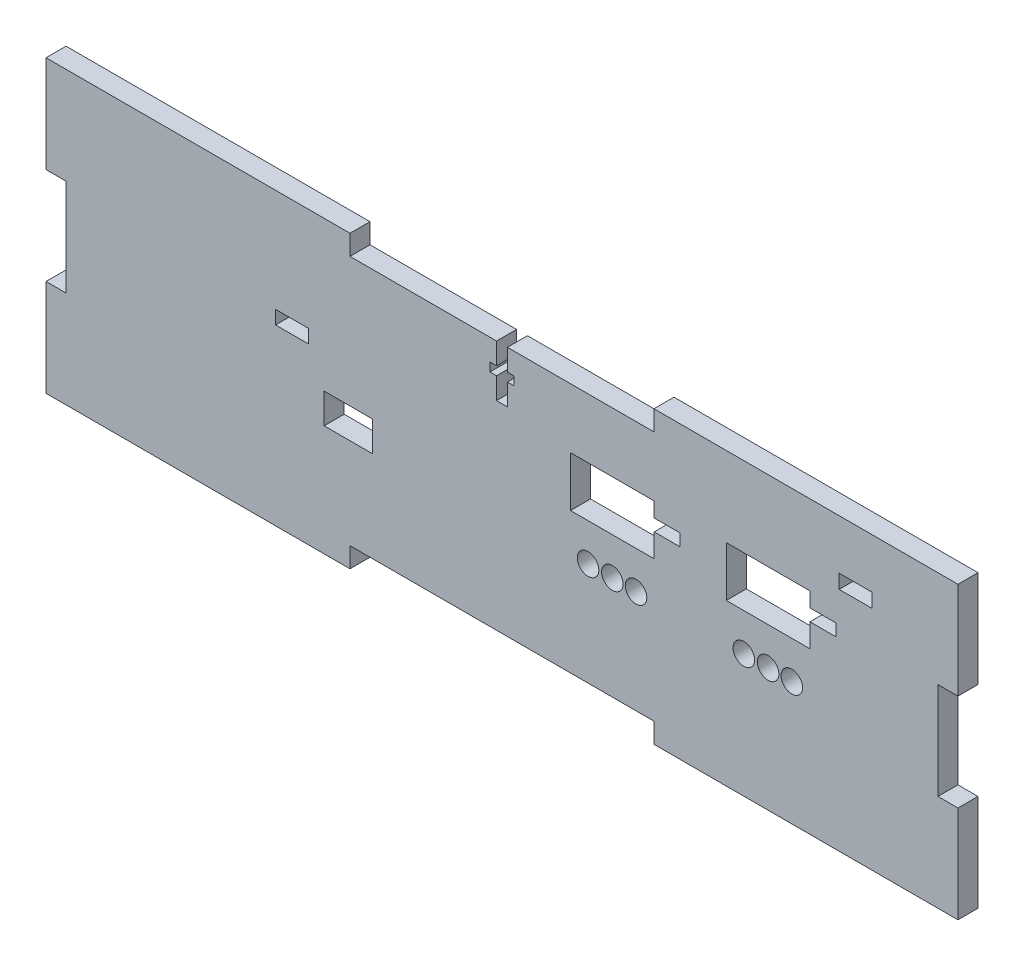
from build123d import *

# Parameters (mm, degrees)
SKETCH1_W           = 231.14
SKETCH1_H           = 73.66
BOSS_EXTRUDE1_DEPTH = 5.08
SKETCH2_W           = 77.046666666
SKETCH2_H           = 5.08
CUT_EXTRUDE1_DEPTH  = 122.402966191
SKETCH3_W           = 5.08
SKETCH3_H           = 24.553333334
CUT_EXTRUDE2_DEPTH  = 122.402966191
SKETCH5_W           = 2.7559
SKETCH5_H           = 13.081
CUT_EXTRUDE4_DEPTH  = 122.402966191
SKETCH6_W           = 6.096
SKETCH6_H           = 2.1717
CUT_EXTRUDE5_DEPTH  = 122.402966191
CAVITY1_OUTLINE_R   = 2.7305
CAVITY1_OUTLINE_W   = 12.202797109
CAVITY1_OUTLINE_H   = 7.62
CAVITY1_OUTLINE_W_2 = 8.382
CAVITY1_OUTLINE_H_2 = 3.429
CAVITY1_OUTLINE_H_3 = 3.556
CAVITY1_DEPTH       = 5.08


# Read off the part's stored shape, not the designer's step: Cavity1
with BuildPart() as part:
    # Sketch1 → Boss-Extrude1 (new body)
    with BuildSketch(Plane.XY):
        Rectangle(SKETCH1_W, SKETCH1_H)
    extrude(amount=BOSS_EXTRUDE1_DEPTH)

    # Sketch2 → Cut-Extrude1 (cut, through all)
    with BuildSketch(Plane.XY.offset(5.08)):
        with Locations((0, -34.29)):
            Rectangle(SKETCH2_W, SKETCH2_H)
        with Locations((0, 34.29)):
            Rectangle(SKETCH2_W, SKETCH2_H)
    extrude(amount=-CUT_EXTRUDE1_DEPTH, mode=Mode.SUBTRACT)

    # Sketch3 → Cut-Extrude2 (cut, through all)
    with BuildSketch(Plane.XY.offset(5.08)):
        with Locations((-113.03, 0)):
            Rectangle(SKETCH3_W, SKETCH3_H)
        with Locations((113.03, 0)):
            Rectangle(SKETCH3_W, SKETCH3_H)
    extrude(amount=-CUT_EXTRUDE2_DEPTH, mode=Mode.SUBTRACT)

    # Sketch5 → Cut-Extrude4 (cut, through all)
    with BuildSketch(Plane.XY.offset(5.08)):
        with Locations((0, 25.2095)):
            Rectangle(SKETCH5_W, SKETCH5_H)
    extrude(amount=-CUT_EXTRUDE4_DEPTH, mode=Mode.SUBTRACT)

    # Sketch6 → Cut-Extrude5 (cut, through all)
    with BuildSketch(Plane.XY.offset(5.08)):
        with Locations((0, 25.2095)):
            Rectangle(SKETCH6_W, SKETCH6_H)
    extrude(amount=-CUT_EXTRUDE5_DEPTH, mode=Mode.SUBTRACT)

    # Cavity1 outline → Cavity1 (cut)
    with BuildSketch(Plane.XY):
        with Locations((21.814879295, -5.588)):
            Circle(CAVITY1_OUTLINE_R)
        with Locations((27.972778565, -5.588)):
            Circle(CAVITY1_OUTLINE_R)
        with Locations((33.971893142, -5.588)):
            Circle(CAVITY1_OUTLINE_R)
        Polygon((38.577278565, 12.877703873), (38.577278565, 16.614191805), (17.368278565, 16.614191805), (17.368278565, 3.914191805), (38.577278565, 3.914191805), (38.577278565, 9.829703873), (45.181278565, 9.829703873), (45.181278565, 12.877703873), align=None)
        Polygon((56.847527144, 3.914191805), (78.056527144, 3.914191805), (78.056527144, 9.829703873), (84.660527144, 9.829703873), (84.660527144, 12.877703873), (78.056527144, 12.877703873), (78.056527144, 16.614191805), (56.847527144, 16.614191805), align=None)
        with Locations((61.294127875, -5.588)):
            Circle(CAVITY1_OUTLINE_R)
        with Locations((67.452027144, -5.588)):
            Circle(CAVITY1_OUTLINE_R)
        with Locations((73.451141721, -5.588)):
            Circle(CAVITY1_OUTLINE_R)
        with Locations((-38.971851196, -4.900880915)):
            Rectangle(CAVITY1_OUTLINE_W, CAVITY1_OUTLINE_H)
        with Locations((-53.192397728, 8.983802784)):
            Rectangle(CAVITY1_OUTLINE_W_2, CAVITY1_OUTLINE_H_2)
        with Locations((89.651170694, 22.423911141)):
            Rectangle(CAVITY1_OUTLINE_W_2, CAVITY1_OUTLINE_H_3)
    extrude(amount=CAVITY1_DEPTH, mode=Mode.SUBTRACT)


solid = part.part
